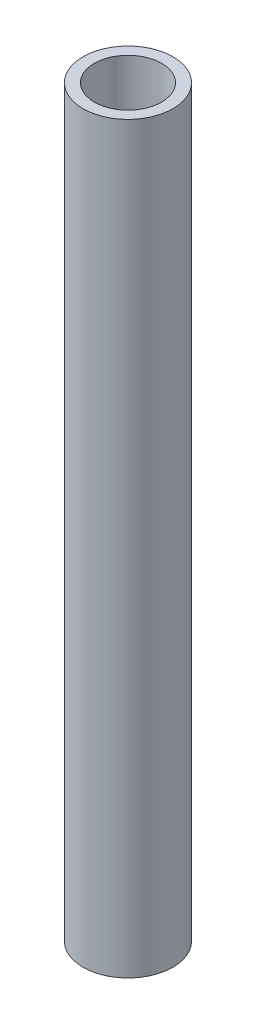
from build123d import *

# Parameters (mm, degrees)
SKETCH1_R           = 12.7
SKETCH1_R_2         = 9.5
BOSS_EXTRUDE1_DEPTH = 210


with BuildPart() as part:
    # Sketch1 → Boss-Extrude1 (new body)
    with BuildSketch(Plane(origin=(0, 0, 0), x_dir=(1, 0, 0), z_dir=(0, 1, 0))):
        Circle(SKETCH1_R)
        Circle(SKETCH1_R_2, mode=Mode.SUBTRACT)
    extrude(amount=BOSS_EXTRUDE1_DEPTH)


solid = part.part
